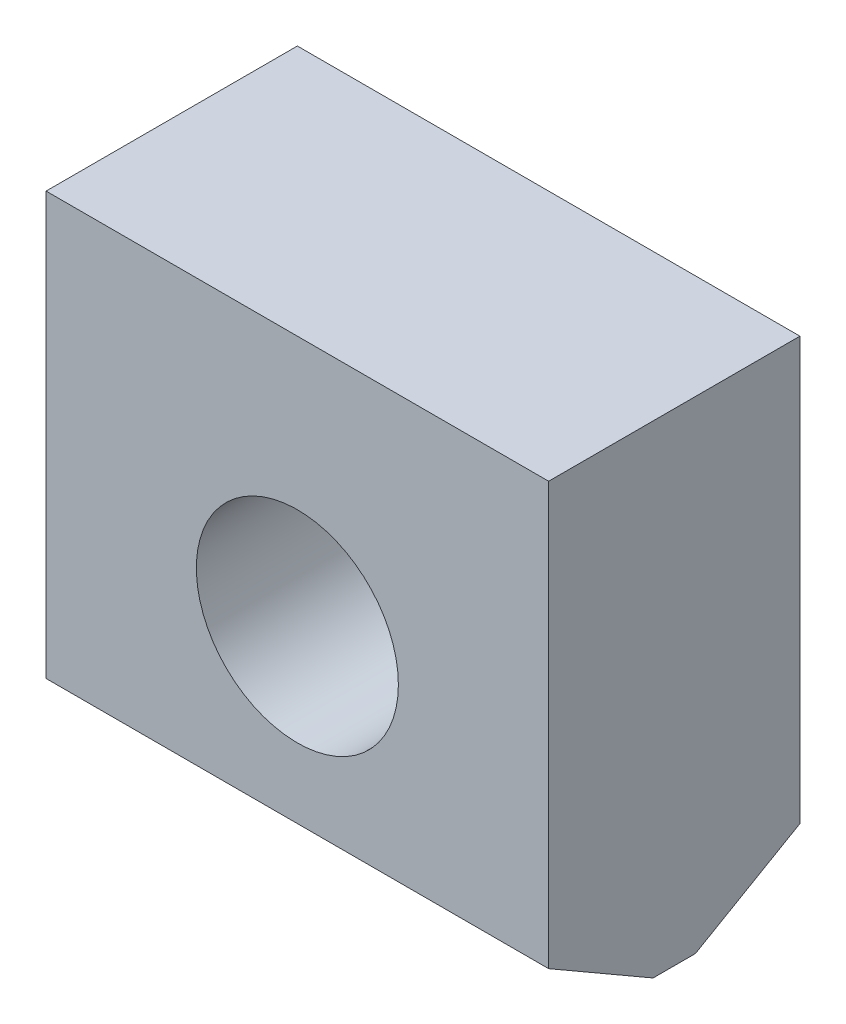
from build123d import *

# Parameters (mm, degrees)
SKETCH_1_W          = 50
SKETCH_1_H          = 48
EXTRUDE_1_DEPTH     = 25
SKETCH_2_R          = 10.05
CUT_EXTRUDE_1_DEPTH = 74.681748079
CHAMFER_1_SIZE      = 6
CHAMFER_1_SIZE2     = 10.392304845
CHAMFER_2_SIZE      = 6
CHAMFER_2_SIZE2     = 10.392304845


with BuildPart() as part:
    # Эскиз1 → Бобышка-Вытянуть1 (new body)
    with BuildSketch(Plane.XY):
        with Locations((25, 24)):
            Rectangle(SKETCH_1_W, SKETCH_1_H)
    extrude(amount=EXTRUDE_1_DEPTH)

    # Эскиз2 → Вырез-Вытянуть1 (cut, through all)
    with BuildSketch(Plane.XY.offset(25)):
        with Locations((25, 23)):
            Circle(SKETCH_2_R)
    extrude(amount=-CUT_EXTRUDE_1_DEPTH, mode=Mode.SUBTRACT)

    # Фаска1
    chamfer_1_edges = [part.edges().sort_by_distance(p)[0] for p in [
        (25, 0, 0),
    ]]
    chamfer_1_side = [part.faces().sort_by_distance(p)[0] for p in [
        (25, 0.693108938, 0),
    ]]
    chamfer(chamfer_1_edges, length=CHAMFER_1_SIZE, length2=CHAMFER_1_SIZE2, reference=chamfer_1_side[0])

    # Фаска2
    chamfer_2_edges = [part.edges().sort_by_distance(p)[0] for p in [
        (25, 0, 25),
    ]]
    chamfer_2_side = [part.faces().sort_by_distance(p)[0] for p in [
        (25, 0.693108938, 25),
    ]]
    chamfer(chamfer_2_edges, length=CHAMFER_2_SIZE, length2=CHAMFER_2_SIZE2, reference=chamfer_2_side[0])


solid = part.part
